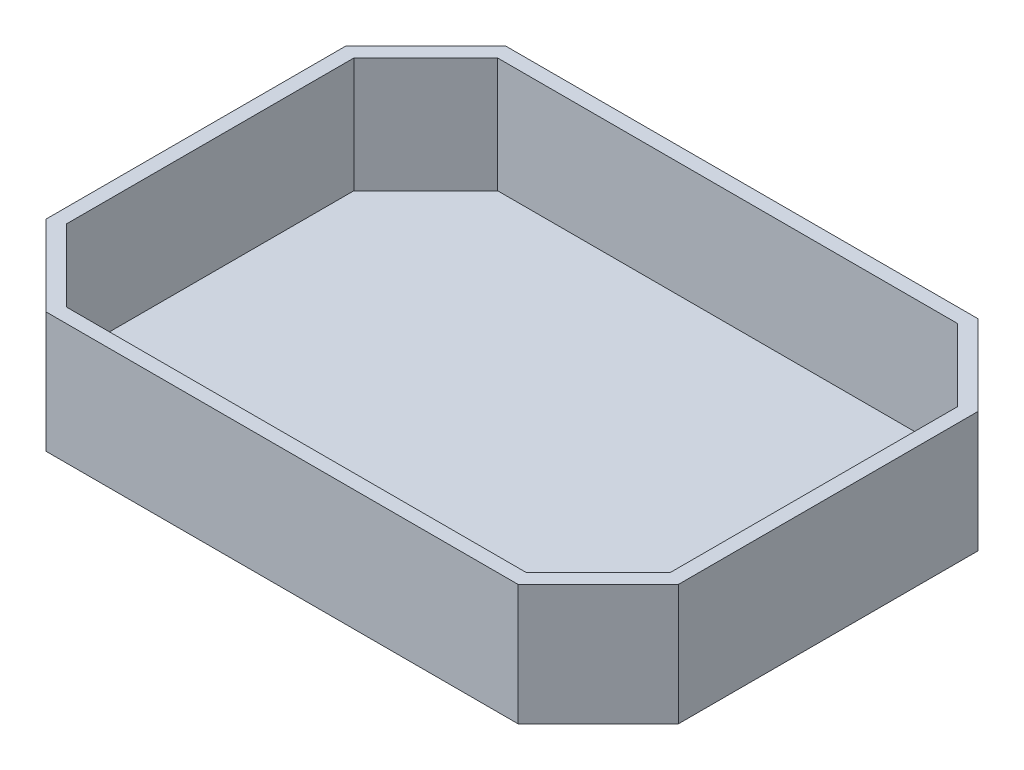
from build123d import *

# Parameters (mm, degrees)
BOSS_EXTRUDE1_DEPTH = 2
BOSS_EXTRUDE2_DEPTH = 40


with BuildPart() as part:
    # Sketch1 → Boss-Extrude1 (new body)
    with BuildSketch(Plane(origin=(0, 0, 0), x_dir=(1, 0, 0), z_dir=(0, 1, 0))):
        Polygon((110, 52.071067812), (110, -52.071067812), (82.071067812, -80), (-82.071067812, -80), (-110, -52.071067812), (-110, 52.071067812), (-82.071067812, 80), (82.071067812, 80), align=None)
    extrude(amount=-BOSS_EXTRUDE1_DEPTH)

    # Sketch1<3> → Boss-Extrude2 (add)
    with BuildSketch(Plane(origin=(0, 0, 0), x_dir=(1, 0, 0), z_dir=(0, 1, 0))):
        Polygon((110, -52.071067812), (110, 52.071067812), (82.071067812, 80), (-82.071067812, 80), (-110, 52.071067812), (-110, -52.071067812), (-82.071067812, -80), (82.071067812, -80), align=None)
        Polygon((-80, 75), (80, 75), (105, 50), (105, -50), (80, -75), (-80, -75), (-105, -50), (-105, 50), align=None, mode=Mode.SUBTRACT)
    extrude(amount=BOSS_EXTRUDE2_DEPTH)


solid = part.part
